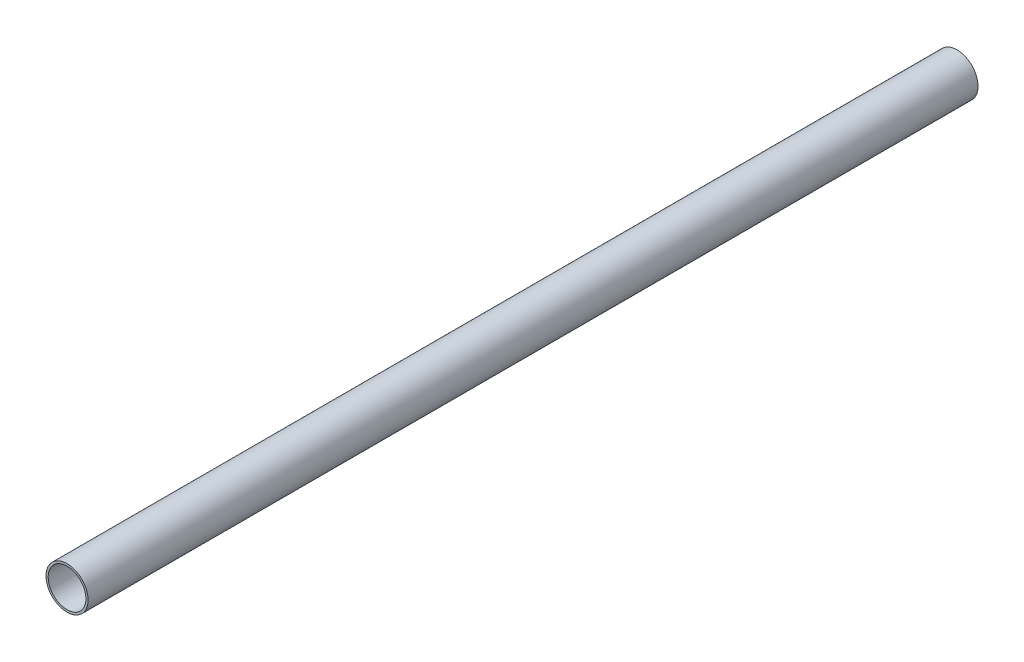
from build123d import *

# Parameters (mm, degrees)
SKETCH1_R           = 11.1125
SKETCH1_R_2         = 9.9695
BOSS_EXTRUDE1_DEPTH = 235


with BuildPart() as part:
    # Sketch1 → Boss-Extrude1 (new, symmetric)
    with BuildSketch(Plane.XY):
        Circle(SKETCH1_R)
        Circle(SKETCH1_R_2, mode=Mode.SUBTRACT)
    extrude(amount=BOSS_EXTRUDE1_DEPTH, both=True)


solid = part.part
